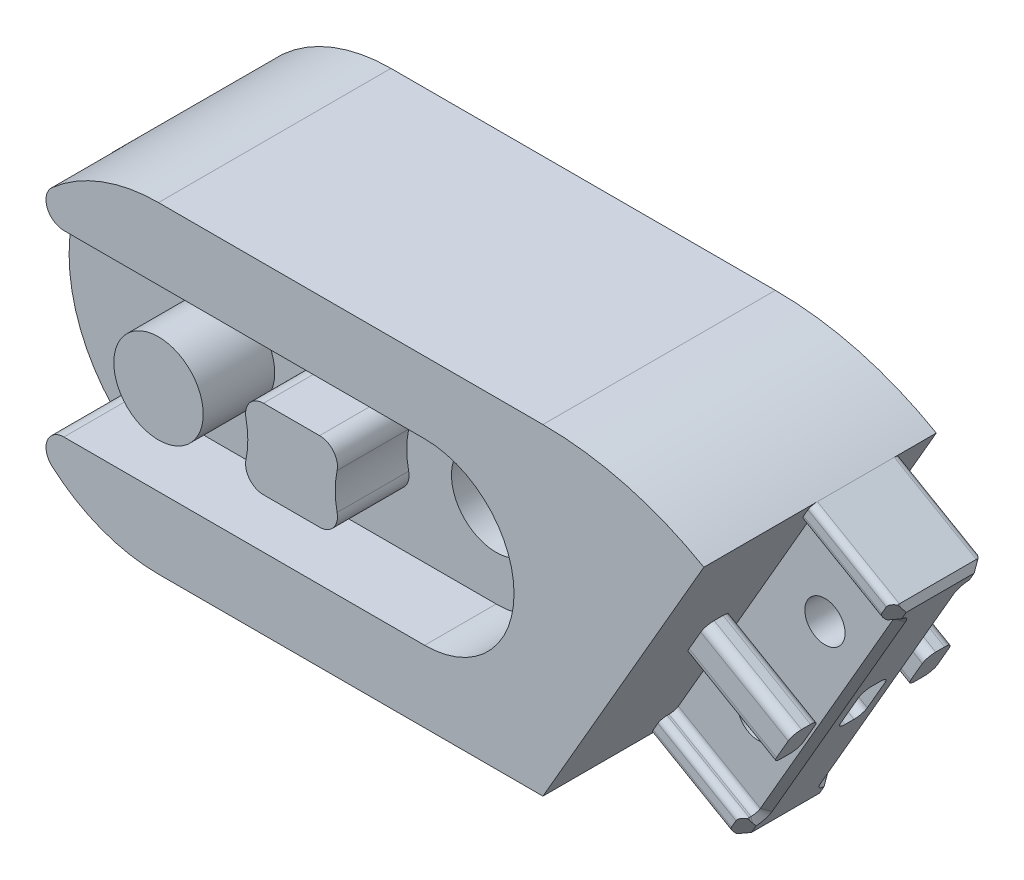
from build123d import *

# Parameters (mm, degrees)
SKETCH_1_R          = 4.9999999999999964
EXTRUDE_1_DEPTH     = 18
SKETCH_2_R          = 5
EXTRUDE_2_DEPTH     = 8
FILLET_2_R          = 2
EXTRUDE_4_DEPTH     = 11.3
SKETCH_8_W          = 3.000000000000001
SKETCH_8_H          = 6.0000000000000036
CUT_EXTRUDE_3_DEPTH = 20
SKETCH_9_R          = 2.250000000000002
CUT_EXTRUDE_4_DEPTH = 78.37023084919184
FILLET_1_R          = 1
EXTRUDE_5_DEPTH     = 8
FILLET_3_R          = 2
EXTRUDE_6_DEPTH     = 11.3
FILLET_4_R          = 0.7
CHAMFER_2_SIZE      = 0.7
CUT_EXTRUDE_5_REACH = 123.985
CUT_EXTRUDE_6_DEPTH = 96.67513972142032


# Read off the part's stored shape, not the designer's step: 镜向1
with BuildPart() as part:
    # 草图1 → 凸台-拉伸1 (new body)
    with BuildSketch(Plane.XY):
        with BuildLine():
            Line((61.00000000000003, -13.176914536239765), (43, 17.999999999999996))
            Line((43, 17.999999999999996), (0, 18))
            ThreePointArc((0, 18), (-18, 2.2e-15), (0, -18))
            Line((0, -18), (43, -17.999999999999996))
            ThreePointArc((43, -17.999999999999996), (52.31748562369077, -16.77332974640645), (61.00000000000003, -13.176914536239765))
        make_face()
        with Locations((29.77, 0)):
            Circle(SKETCH_1_R, mode=Mode.SUBTRACT)
    extrude(amount=EXTRUDE_1_DEPTH)

    # 草图2 → 凸台-拉伸2 (add)
    with BuildSketch(Plane.XY.offset(18)):
        with BuildLine():
            Line((8.951308150188659, -4.435), (20.807256279464415, -4.435))
            ThreePointArc((20.807256279464415, -4.434999999999999), (19.769999999999996, 4.4e-16), (20.807256279464415, 4.435))
            Line((20.807256279464415, 4.435), (8.951308150188659, 4.435))
            ThreePointArc((8.951308150188659, 4.434999999999999), (9.989751878782268, -6.7e-16), (8.951308150188659, -4.435))
        make_face()
        Circle(SKETCH_2_R)
    extrude(amount=EXTRUDE_2_DEPTH)

    # 圆角2
    fillet_2_edges = [part.edges().sort_by_distance(p)[0] for p in [
        (20.807256279464415, -4.434999999999999, 22),
        (20.807256279464415, 4.434999999999999, 22),
        (8.951308150188659, 4.434999999999999, 22),
        (8.951308150188659, -4.434999999999999, 22),
    ]]
    fillet(fillet_2_edges, radius=FILLET_2_R)

    # 草图7 → 凸台-拉伸4 (add)
    with BuildSketch(Plane(origin=(33.99999999999993, 33.588457268120045, 0), x_dir=(0, 0, -1), z_dir=(-0.866025403784438, -0.5000000000000009, 0))):
        Polygon((-5.599999999999984, 54.00000000000014), (-12.400000000000015, 54.00000000000014), (-12.400000000000004, 18.00000000000018), (-5.599999999999972, 18.00000000000019), align=None)
        Polygon((-2.9999999999999973, 33.70000000000016), (-1.041e-14, 33.70000000000016), (-1.041e-14, 38.30000000000017), (-2.9999999999999956, 38.30000000000017), align=None)
        Polygon((-15.000000000000004, 38.30000000000017), (-17.99999999999999, 38.30000000000017), (-17.99999999999999, 33.70000000000016), (-15.000000000000002, 33.70000000000016), align=None)
    extrude(amount=-EXTRUDE_4_DEPTH)

    # 草图8 → 切除-拉伸3 (cut)
    with BuildSketch(Plane(origin=(49.8303156968241, 28.769546181365495, -2.936e-14), x_dir=(-5.4e-16, -3.2e-16, 1), z_dir=(0.866025403784438, 0.500000000000001, 0))):
        with Locations((8.99999999999995, 23.911542731880154)):
            Rectangle(SKETCH_8_W, SKETCH_8_H)
    extrude(amount=-CUT_EXTRUDE_3_DEPTH, mode=Mode.SUBTRACT)

    # 草图9 → 切除-拉伸4 (cut, through all)
    with BuildSketch(Plane(origin=(-8.8e-16, 1.52e-15, 5.59999999999997), x_dir=(-1, 0, -1e-16), z_dir=(1e-16, -1.7e-16, -1))):
        with Locations(Location((-60.946152422706646, -1.0836477965031495, 0), (0, 0, 90))):
            Circle(SKETCH_9_R)
        with Locations(Location((-53.44615242270663, 11.90673326026341, 0), (0, 0, 90))):
            Circle(SKETCH_9_R)
    extrude(amount=-CUT_EXTRUDE_4_DEPTH, mode=Mode.SUBTRACT)

    # 圆角1
    fillet_1_edges = [part.edges().sort_by_distance(p)[0] for p in [
        (54.62583302491982, 0.4634665205268087, 10.499999999999913),
        (51.625833024919814, 5.659618943233441, 10.499999999999913),
        (51.625833024919814, 5.659618943233441, 7.499999999999914),
        (54.62583302491982, 0.4634665205268087, 7.499999999999914),
        (55.74304353138211, 7.2284011605843475, 17.99999999999999),
        (58.043043531382125, 3.244684303175926, 17.99999999999999),
        (58.043043531382125, 3.244684303175926, 15.000000000000004),
        (55.74304353138211, 7.2284011605843475, 15.000000000000002),
        (55.74304353138211, 7.2284011605843475, 2.9999999999999973),
        (58.043043531382125, 3.244684303175926, 2.9999999999999956),
        (58.043043531382125, 3.244684303175926, 1.041e-14),
        (55.74304353138211, 7.2284011605843475, 1.041e-14),
    ]]
    fillet(fillet_1_edges, radius=FILLET_1_R)

    # 草图10 → 凸台-拉伸5 (add)
    with BuildSketch(Plane.XY.offset(18)):
        with BuildLine():
            Line((29.77, -10), (-14.966629547095765, -10))
            ThreePointArc((-14.966629547095765, -10), (-8.48528137423857, -15.874507866387544), (0, -18.000000000000004))
            Line((0, -18.000000000000004), (43, -17.999999999999996))
            ThreePointArc((43, -17.999999999999996), (52.31748562369077, -16.77332974640645), (61.00000000000003, -13.176914536239769))
            Line((61.00000000000003, -13.176914536239769), (43, 17.999999999999996))
            Line((43, 17.999999999999996), (0, 18.000000000000004))
            ThreePointArc((0, 18.000000000000004), (-8.485281374238571, 15.874507866387546), (-14.966629547095765, 10))
            Line((-14.966629547095765, 10), (29.77, 10))
            ThreePointArc((29.77, 10), (39.769999999999996, 0), (29.77, -10))
        make_face()
    extrude(amount=EXTRUDE_5_DEPTH)

    # 圆角3
    fillet_3_edges = [part.edges().sort_by_distance(p)[0] for p in [
        (-14.966629547095767, 10, 22),
        (-14.966629547095767, -10.000000000000002, 22),
    ]]
    fillet(fillet_3_edges, radius=FILLET_3_R)

    # 草图11 → 凸台-拉伸6 (add)
    with BuildSketch(Plane(origin=(49.8303156968241, 28.769546181365495, -2.936e-14), x_dir=(5.8e-16, 2.6e-16, -1), z_dir=(0.866025403784438, 0.500000000000001, 0))):
        Polygon((-12.400000000000041, -39.51154273188015), (-13.999999999999961, -39.51154273188015), (-13.999999999999966, -41.91154273188013), (-12.400000000000041, -41.91154273188013), align=None)
        Polygon((-3.999999999999961, -39.51154273188015), (-5.6000000000000085, -39.51154273188015), (-5.60000000000001, -41.91154273188014), (-3.99999999999997, -41.91154273188013), align=None)
        Polygon((-5.600000000000001, -5.911542731880182), (-5.600000000000002, -8.31154273188016), (-3.999999999999961, -8.31154273188016), (-3.999999999999969, -5.911542731880172), align=None)
        Polygon((-13.999999999999966, -5.911542731880174), (-13.999999999999966, -8.31154273188016), (-12.400000000000034, -8.31154273188016), (-12.400000000000034, -5.911542731880178), align=None)
    extrude(amount=-EXTRUDE_6_DEPTH)

    # 圆角4
    fillet_4_edges = [part.edges().sort_by_distance(p)[0] for p in [
        (64.69304353138213, -8.273453567157098, 13.999999999999932),
        (64.69304353138213, -8.273453567157091, 12.40000000000001),
        (65.89304353138213, -10.35191453623974, 13.999999999999936),
        (64.69304353138213, -8.273453567157091, 5.599999999999978),
        (64.69304353138213, -8.273453567157091, 3.9999999999999343),
        (65.89304353138213, -10.351914536239732, 3.999999999999939),
        (47.89304353138211, 20.825000000000003, 3.999999999999937),
        (49.09304353138211, 18.74653903091736, 3.999999999999932),
        (49.09304353138211, 18.74653903091736, 5.5999999999999694),
        (49.09304353138211, 18.746539030917358, 13.99999999999993),
        (49.09304353138211, 18.746539030917358, 12.4),
        (47.89304353138211, 20.825, 13.999999999999932),
    ]]
    fillet(fillet_4_edges, radius=FILLET_4_R)

    # 倒角2
    chamfer_2_edges = [part.edges().sort_by_distance(p)[0] for p in [
        (53.986087062764184, 21.571539030917368, 4.799999999999956),
        (61.7860870627642, 8.061542731880138, 12.40000000000001),
        (69.58608706276421, -5.448453567157085, 13.199999999999976),
        (70.1860870627642, -6.4876840516984196, 13.999999999999938),
        (70.78608706276421, -7.52691453623973, 8.99999999999994),
        (70.1860870627642, -6.487684051698405, 3.999999999999942),
        (69.58608706276421, -5.448453567157085, 4.799999999999963),
        (61.786087062764196, 8.061542731880149, 5.599999999999977),
        (53.38608706276419, 22.61076951545869, 3.99999999999994),
        (52.78608706276419, 23.650000000000006, 8.99999999999994),
        (53.38608706276418, 22.610769515458685, 13.999999999999936),
        (53.986087062764184, 21.571539030917364, 13.199999999999969),
        (70.6835744361795, -7.349357458577688, 4.205025253169361),
        (70.6835744361795, -7.349357458577694, 13.794974746830517),
        (52.88859968934889, 23.47244292233795, 13.79497474683052),
        (52.888599689348894, 23.472442922337958, 4.205025253169356),
        (69.6885996893489, -5.626010644819133, 4.20502525316936),
        (69.6885996893489, -5.62601064481914, 13.79497474683052),
        (53.883574436179465, 21.749096108579412, 13.794974746830519),
        (53.88357443617947, 21.74909610857942, 4.205025253169357),
        (54.0885996893489, 21.393981953255317, 5.394974746830557),
        (54.08859968934889, 21.393981953255313, 12.60502525316942),
        (69.4835744361795, -5.27089648949504, 12.60502525316943),
        (69.48357443617951, -5.270896489495035, 5.394974746830568),
    ]]
    chamfer(chamfer_2_edges, length=CHAMFER_2_SIZE)

    # 切除-拉伸5: up to this face of the body (flat: up to its plane)
    cut_extrude_5_end = Plane(part.part.faces().sort_by_distance((47.58993464, 20.65, 9))[0])
    # 草图12 → 切除-拉伸5 (cut, up to the picked face)
    with BuildSketch(Plane(origin=(98.23909236273093, 8.323085463760323, 0), x_dir=(-0.866025403784438, -0.500000000000001, 0), z_dir=(-0.500000000000001, 0.866025403784438, 0)), mode=Mode.PRIVATE) as cut_extrude_5_sk1:
        Polygon((31.700000000000067, 12.799999999999999), (31.700000000000067, 13.999999999999998), (32.90000000000007, 13.999999999999996), align=None)
    cut_extrude_5_tool1 = split(extrude(cut_extrude_5_sk1.sketch, amount=CUT_EXTRUDE_5_REACH, mode=Mode.PRIVATE), bisect_by=cut_extrude_5_end, keep=Keep.BOTH, mode=Mode.PRIVATE)
    # 草图12 → 切除-拉伸5 (cut, up to the picked face)
    with BuildSketch(Plane(origin=(98.23909236273093, 8.323085463760323, 0), x_dir=(-0.866025403784438, -0.500000000000001, 0), z_dir=(-0.500000000000001, 0.866025403784438, 0)), mode=Mode.PRIVATE) as cut_extrude_5_sk2:
        Polygon((31.700000000000067, 4.0000000000000036), (32.90000000000007, 4.000000000000005), (31.700000000000067, 5.200000000000003), align=None)
    cut_extrude_5_tool2 = split(extrude(cut_extrude_5_sk2.sketch, amount=CUT_EXTRUDE_5_REACH, mode=Mode.PRIVATE), bisect_by=cut_extrude_5_end, keep=Keep.BOTH, mode=Mode.PRIVATE)
    add(cut_extrude_5_tool1.solids().sort_by(Axis((70.439677, -7.726915, 13.6), (-0.500000000000001, 0.866025403784438, 0)))[0], mode=Mode.SUBTRACT)
    add(cut_extrude_5_tool2.solids().sort_by(Axis((70.439677, -7.726915, 4.4), (-0.500000000000001, 0.866025403784438, 0)))[0], mode=Mode.SUBTRACT)

    # 镜向1: part across plane


with BuildPart() as part_1:
    add(part.part)
    add(part.part.mirror(Plane(origin=(0, -18, 18), x_dir=(0, 0, 1), z_dir=(-8e-17, 1, 0))))

    # 草图13 → 切除-拉伸6 (cut, through all)
    with BuildSketch(Plane.XY.offset(26)):
        Polygon((-3.31e-15, -17.999999999999996), (43, -17.999999999999996), (87.8218201095251, -17.999999999999996), (87.8218201095251, 39.78196622179553), (-28.896212069890126, 39.78196622179553), (-28.896212069890126, -17.999999999999996), align=None)
    extrude(amount=-CUT_EXTRUDE_6_DEPTH, mode=Mode.SUBTRACT)


solid = part_1.part
